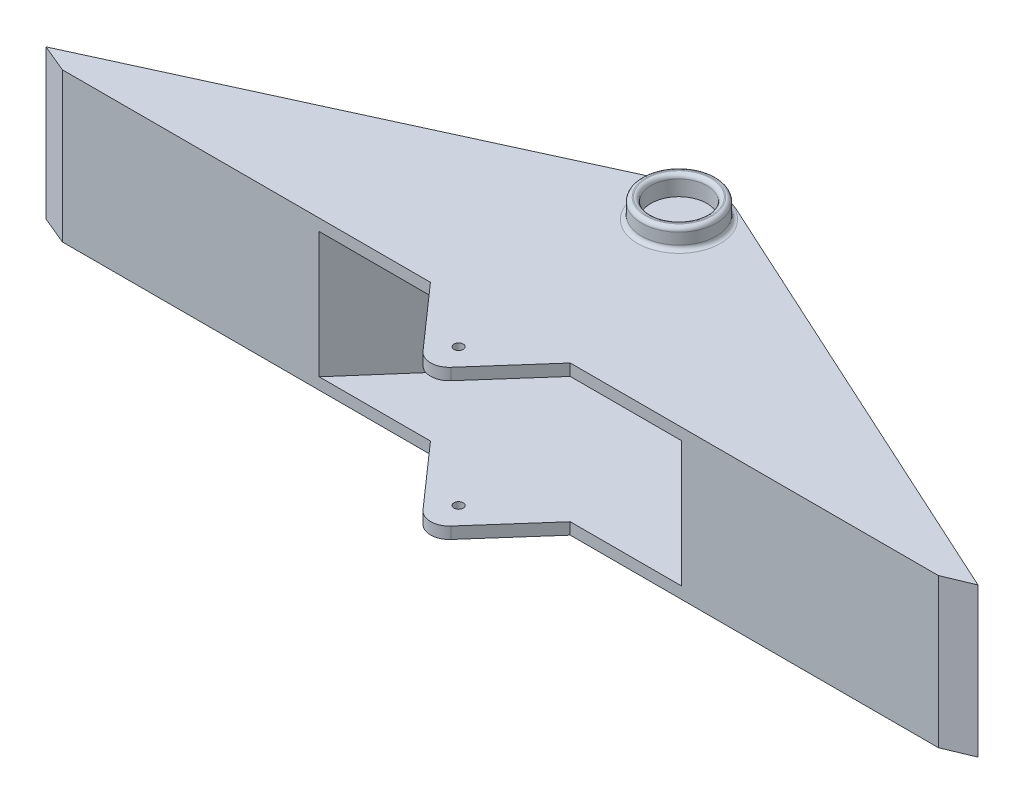
from build123d import *

# Parameters (mm, degrees)
BOSS_EXTRUDE1_DEPTH          = 1.25
BOSS_EXTRUDE8_START          = -8
BOSS_EXTRUDE8_DEPTH          = 16
CHAMFER2_SIZE2               = 3
CHAMFER2_SIZE                = 1.25
CHAMFER3_SIZE2               = 3
CHAMFER3_SIZE                = 1.25
BOSS_EXTRUDE9_DEPTH          = 1.25
BOSS_EXTRUDE10_DEPTH         = 1.25
CUT_EXTRUDE1_REACH           = 59.082
SKETCH6_R                    = 0.5
SCHIZZO1_R                   = 4
SCHIZZO1_R_2                 = 3
ESTRUSIONE_ESTRUSIONE1_DEPTH = 2.1
RACCORDO1_R                  = 0.45


with BuildPart() as part:
    # Sketch1 → Boss-Extrude1 (new body)
    with BuildSketch(Plane(origin=(0, 0, 0), x_dir=(1, 0, 0), z_dir=(0, 1, 0))):
        with BuildLine():
            Line((-50, 0), (-2.082988952, 21.95833302))
            ThreePointArc((-2.082988952, 21.95833302), (0, 22.412878475), (2.082988952, 21.95833302))
            Line((2.082988952, 21.95833302), (50, 0))
            Line((50, 0), (20, 0))
            Line((20, 0), (0.753370804, 22.049783791))
            ThreePointArc((0.753370804, 22.049783791), (0, 22.392187842), (-0.753370804, 22.049783791))
            Line((-0.753370804, 22.049783791), (-20, 0))
            Line((-20, 0), (-50, 0))
        make_face()
    extrude(amount=BOSS_EXTRUDE1_DEPTH)


with BuildPart() as body_2:
    # Body-Move/Copy1: copy of part
    add(part.part.moved(Location((0, 14.75, 0))))


with BuildPart() as part_1:
    add(part.part)

    add(body_2.part)  # Boss-Extrude8 merges body 2
    # Sketch3 → Boss-Extrude8 (add)
    with BuildSketch(Plane(origin=(0, 8, 0), x_dir=(1, 0, 0), z_dir=(0, 1, 0)).offset(BOSS_EXTRUDE8_START)):
        with BuildLine():
            Line((19.431879943, -1.25), (0, 21.012015184))
            Line((0, 21.012015184), (-19.431879943, -1.25))
            Line((-19.431879943, -1.25), (-50, -1.25))
            Line((-50, -1.25), (-50, 0))
            Line((-50, 0), (-20, 0))
            Line((-20, 0), (-0.753370804, 22.049783791))
            ThreePointArc((-0.753370804, 22.049783791), (0, 22.392187842), (0.753370804, 22.049783791))
            Line((0.753370804, 22.049783791), (20, 0))
            Line((20, 0), (50, 0))
            Line((50, 0), (50, -1.25))
            Line((50, -1.25), (19.431879943, -1.25))
        make_face()
    extrude(amount=BOSS_EXTRUDE8_DEPTH)

    # Chamfer2
    chamfer2_edges = [part_1.edges().sort_by_distance(p)[0] for p in [
        (50, 8, 1.25),
    ]]
    chamfer2_side = [part_1.faces().sort_by_distance(p)[0] for p in [
        (50, 8, 1.225),
    ]]
    chamfer(chamfer2_edges, length=CHAMFER2_SIZE - 0.0001, length2=CHAMFER2_SIZE2 - 0.0001, reference=chamfer2_side[0])  # a hair under: the kernel refuses the full size

    # Chamfer3
    chamfer3_edges = [part_1.edges().sort_by_distance(p)[0] for p in [
        (-50, 8, 1.25),
    ]]
    chamfer3_side = [part_1.faces().sort_by_distance(p)[0] for p in [
        (-50, 8, 1.225),
    ]]
    chamfer(chamfer3_edges, length=CHAMFER3_SIZE - 0.0001, length2=CHAMFER3_SIZE2 - 0.0001, reference=chamfer3_side[0])  # a hair under: the kernel refuses the full size

    # Sketch4 → Boss-Extrude9 (add)
    with BuildSketch(Plane(origin=(0, 16, 0), x_dir=(1, 0, 0), z_dir=(0, 1, 0))):
        Polygon((-19.431879943, -1.25), (0, 21.012015184), (19.431879943, -1.25), align=None)
    boss_extrude9 = extrude(amount=-BOSS_EXTRUDE9_DEPTH)

    # Mirror1: Boss-Extrude9 across plane
    add(boss_extrude9.mirror(Plane.ZX.offset(8)))

    # Sketch5 → Boss-Extrude10 (add)
    with BuildSketch(Plane.XZ):
        with BuildLine():
            Line((-7.5, 1.25), (7.5, 1.25))
            Line((7.5, 1.25), (1.499675711, 8.050367528))
            ThreePointArc((1.499675711, 8.050367528), (0, 8.727124254), (-1.499675711, 8.050367528))
            Line((-1.499675711, 8.050367528), (-7.5, 1.25))
        make_face()
    boss_extrude10 = extrude(amount=-BOSS_EXTRUDE10_DEPTH)

    # Mirror2: Boss-Extrude10 across plane
    add(boss_extrude10.mirror(Plane.ZX.offset(8)))

    # Sketch6 → Cut-Extrude1 (cut, up to next)
    with BuildSketch(Plane(origin=(0, 0, 0), x_dir=(-1, 0, 0), z_dir=(0, -1, 0)), mode=Mode.PRIVATE) as cut_extrude1_sk1:
        with Locations(Location((0, -5.727124254, 0), (0, 0, 90))):
            Circle(SKETCH6_R)
    cut_extrude1_tool1 = extrude(cut_extrude1_sk1.sketch, amount=-CUT_EXTRUDE1_REACH, mode=Mode.PRIVATE) & part_1.part
    add(cut_extrude1_tool1.solids().sort_by_distance((0, 0, 5.727124))[0], mode=Mode.SUBTRACT)
    add(cut_extrude1_tool1.solids().sort_by_distance((0, 0, 5.727124))[1], mode=Mode.SUBTRACT)

    # Schizzo1 → Estrusione-Estrusione1 (add)
    with BuildSketch(Plane(origin=(0, 16, 0), x_dir=(1, 0, 0), z_dir=(0, 1, 0))):
        with Locations(Location((0, 17.912878475, 0), (0, 0, 270))):
            Circle(SCHIZZO1_R)
        with Locations(Location((0, 17.912878475, 0), (0, 0, 270))):
            Circle(SCHIZZO1_R_2, mode=Mode.SUBTRACT)
    extrude(amount=ESTRUSIONE_ESTRUSIONE1_DEPTH)

    # Raccordo1
    raccordo1_edges = [part_1.edges().sort_by_distance(p)[0] for p in [
        (0, 18.1, -21.912878475),
        (0, 16, -21.912878475),
        (0, 18.1, -20.912878475),
    ]]
    fillet(raccordo1_edges, radius=RACCORDO1_R)


solid = part_1.part
